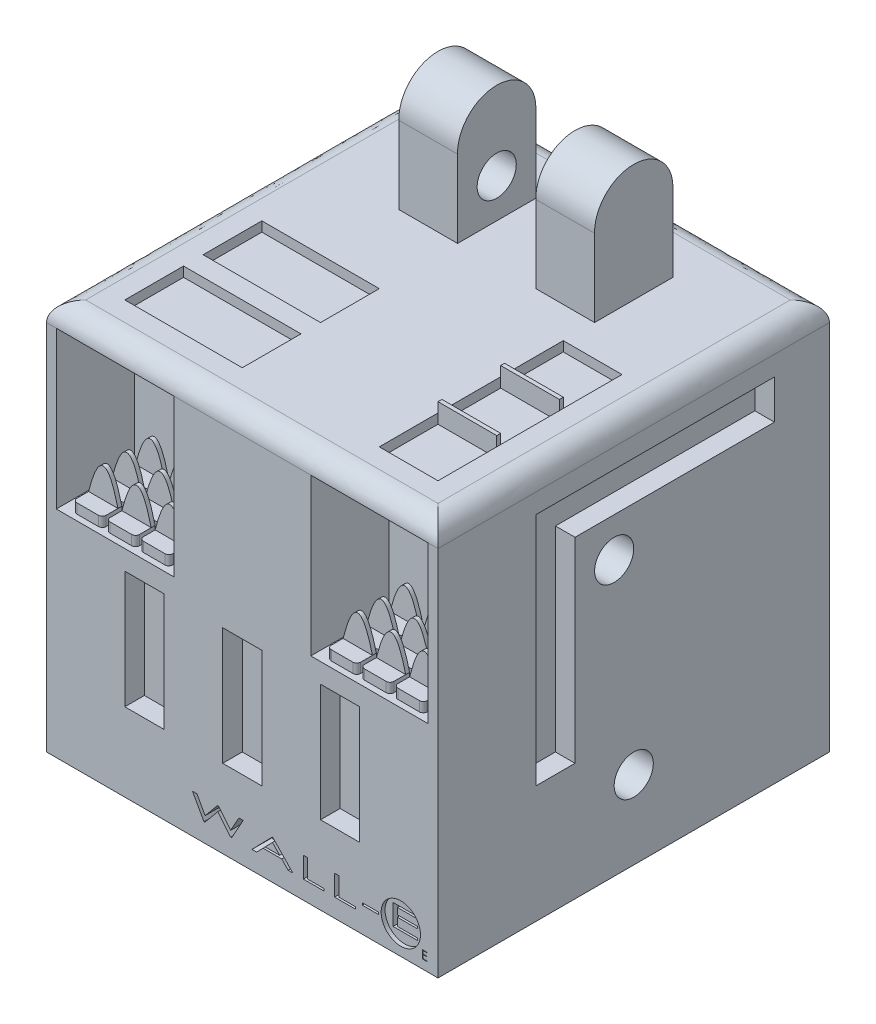
from build123d import *

# Parameters (mm, degrees)
SKETCH2_W            = 100
SKETCH2_H            = 100
BOSS_EXTRUDE1_DEPTH  = 100
VARFILLET1_R         = 5
SKETCH5_W            = 30
SKETCH5_H            = 40
CUT_EXTRUDE3_DEPTH   = 20
SKETCH7_W            = 10
SKETCH7_H            = 30
CUT_EXTRUDE4_DEPTH   = 5
SKETCH8_W            = 4.1383547
SKETCH8_H            = 0.542735043
CUT_EXTRUDE5_DEPTH   = 5
SKETCH9_R            = 5.029787576
CUT_EXTRUDE6_DEPTH   = 1
SKETCH11_W           = 30
SKETCH11_H           = 15
SKETCH11_W_2         = 15
CUT_EXTRUDE9_DEPTH   = 2.5
SKETCH18_W           = 15
SKETCH18_H           = 20
BOSS_EXTRUDE5_DEPTH  = 20
SKETCH19_R           = 10.003218186
BOSS_EXTRUDE6_DEPTH  = 15
SKETCH20_R           = 5
CUT_EXTRUDE11_DEPTH  = 10
SKETCH21_R           = 5
CUT_EXTRUDE12_DEPTH  = 10
CUT_EXTRUDE13_DEPTH  = 5
CUT_EXTRUDE14_DEPTH  = 0.1
SKETCH24_W           = 15
SKETCH24_H           = 1
BOSS_EXTRUDE8_DEPTH  = 2.5
SKETCH25_W           = 15
SKETCH25_H           = 1
BOSS_EXTRUDE9_DEPTH  = 2.5
BOSS_EXTRUDE10_DEPTH = 2.5
BOSS_EXTRUDE11_DEPTH = 1
BOSS_EXTRUDE12_DEPTH = 1
BOSS_EXTRUDE13_DEPTH = 1


with BuildPart() as part:
    # Sketch2 → Boss-Extrude1 (new body)
    with BuildSketch(Plane(origin=(0, 0, 0), x_dir=(1, 0, 0), z_dir=(0, 1, 0))):
        with Locations((28.106508876, -7.100591716)):
            Rectangle(SKETCH2_W, SKETCH2_H)
    extrude(amount=BOSS_EXTRUDE1_DEPTH)

    # VarFillet1
    varfillet1_edges = [part.edges().sort_by_distance(p)[0] for p in [
        (-21.893491124, 100, 7.100591716),
        (28.106508876, 100, -42.899408284),
        (78.106508876, 100, 7.100591716),
        (28.106508876, 100, 57.100591716),
    ]]
    fillet(varfillet1_edges, radius=VARFILLET1_R)

    # Sketch5 → Cut-Extrude3 (cut)
    with BuildSketch(Plane.XY.offset(57.100591716)):
        with Locations((-4.393491124, 75)):
            Rectangle(SKETCH5_W, SKETCH5_H)
        with Locations((60.606508876, 75)):
            Rectangle(SKETCH5_W, SKETCH5_H)
    extrude(amount=-CUT_EXTRUDE3_DEPTH, mode=Mode.SUBTRACT)

    # Sketch7 → Cut-Extrude4 (cut)
    with BuildSketch(Plane.XY.offset(57.100591716)):
        with Locations((3.106508876, 35)):
            Rectangle(SKETCH7_W, SKETCH7_H)
        with Locations((28.106508876, 35)):
            Rectangle(SKETCH7_W, SKETCH7_H)
        with Locations((53.106508876, 35)):
            Rectangle(SKETCH7_W, SKETCH7_H)
    extrude(amount=-CUT_EXTRUDE4_DEPTH, mode=Mode.SUBTRACT)

    # Sketch8 → Cut-Extrude5 (cut)
    # profile 1 of 6: a face of its own
    with BuildSketch(Plane.XY.offset(57.100591716)):
        Polygon((15.395497417, 9.974963751), (16.522308648, 9.974963751), (18.617986733, 6.175818452), (21.77051411, 9.974963751), (22.023861132, 9.974963751), (25.130807246, 6.175818452), (27.257226183, 9.974963751), (28.353296562, 9.974963751), (25.392634503, 4.683297084), (25.146707687, 4.683297084), (21.874396989, 8.685968024), (18.553324941, 4.683297084), (18.313758301, 4.683297084), align=None)
    # profile 2 of 6: a face of its own
    with BuildSketch(Plane.XY.offset(57.100591716)):
        Polygon((35.931234596, 9.974963751), (41.019375622, 4.683297084), (39.821542422, 4.683297084), (38.190157206, 6.379344093), (33.422145053, 6.379344093), (31.770619278, 4.683297084), (30.571726049, 4.683297084), (35.727708955, 9.974963751), align=None)
        Polygon((35.82205157, 8.842852373), (33.952159743, 6.922079135), (37.668622751, 6.922079135), align=None, mode=Mode.SUBTRACT)
    # profile 3 of 6: a face of its own
    with BuildSketch(Plane.XY.offset(57.100591716)):
        Polygon((43.712698272, 9.974963751), (44.798168357, 9.974963751), (44.798168357, 5.226032127), (49.004364938, 5.226032127), (49.004364938, 4.683297084), (43.712698272, 4.683297084), align=None)
    # profile 4 of 6: a face of its own
    with BuildSketch(Plane.XY.offset(57.100591716)):
        Polygon((51.697687588, 9.974963751), (52.783157673, 9.974963751), (52.783157673, 5.226032127), (56.989354254, 5.226032127), (56.989354254, 4.683297084), (51.697687588, 4.683297084), align=None)
    # profile 5 of 6: a face of its own
    with BuildSketch(Plane.XY.offset(57.100591716)):
        with Locations((60.86990981, 6.718553495)):
            Rectangle(SKETCH8_W, SKETCH8_H)
    # profile 6 of 6: a face of its own
    with BuildSketch(Plane.XY.offset(57.100591716)):
        Polygon((65.63240981, 9.974963751), (71.941704682, 9.974963751), (71.941704682, 9.432228708), (66.717879895, 9.432228708), (66.717879895, 7.80402358), (71.873862801, 7.80402358), (71.873862801, 7.261288537), (66.717879895, 7.261288537), (66.717879895, 5.226032127), (71.873862801, 5.226032127), (71.873862801, 4.683297084), (65.63240981, 4.683297084), align=None)
    extrude(amount=-CUT_EXTRUDE5_DEPTH, mode=Mode.SUBTRACT)

    # Sketch9 → Cut-Extrude6 (cut)
    with BuildSketch(Plane.XY.offset(57.100591716)):
        with Locations((68.606508876, 7.3)):
            Circle(SKETCH9_R)
    extrude(amount=-CUT_EXTRUDE6_DEPTH, mode=Mode.SUBTRACT)

    # Sketch11 → Cut-Extrude9 (cut)
    with BuildSketch(Plane(origin=(0, 100, 0), x_dir=(1, 0, 0), z_dir=(0, 1, 0))):
        with Locations((3.106508876, -39.600591716)):
            Rectangle(SKETCH11_W, SKETCH11_H)
        with Locations((3.106508876, -19.600591716)):
            Rectangle(SKETCH11_W, SKETCH11_H)
        with Locations((60.606508876, -39.600591716)):
            Rectangle(SKETCH11_W_2, SKETCH11_H)
        with Locations((60.606508876, -23.600591716)):
            Rectangle(SKETCH11_W_2, SKETCH11_H)
        with Locations((60.606508876, -7.600591716)):
            Rectangle(SKETCH11_W_2, SKETCH11_H)
    extrude(amount=-CUT_EXTRUDE9_DEPTH, mode=Mode.SUBTRACT)

    # Sketch18 → Boss-Extrude5 (add)
    with BuildSketch(Plane(origin=(0, 100, 0), x_dir=(1, 0, 0), z_dir=(0, 1, 0))):
        with Locations((10.606508876, 17.899408284)):
            Rectangle(SKETCH18_W, SKETCH18_H)
    boss_extrude5 = extrude(amount=BOSS_EXTRUDE5_DEPTH)

    # Sketch19 → Boss-Extrude6 (add)
    with BuildSketch(Plane.ZY.offset(-3.106508876)):
        with Locations((-17.899408284, 120)):
            Circle(SKETCH19_R)
    boss_extrude6 = extrude(amount=-BOSS_EXTRUDE6_DEPTH)

    # Sketch20 → Cut-Extrude11 (cut)
    with BuildSketch(Plane(origin=(18.106508876, 0, 0), x_dir=(0, 0, -1), z_dir=(1, 0, 0))):
        with Locations((17.899408284, 110)):
            Circle(SKETCH20_R)
    cut_extrude11 = extrude(amount=-CUT_EXTRUDE11_DEPTH, mode=Mode.SUBTRACT)

    # Sketch21 → Cut-Extrude12 (cut)
    with BuildSketch(Plane(origin=(78.106508876, 0, 0), x_dir=(0, 0, -1), z_dir=(1, 0, 0))):
        with Locations((-12.100591716, 70)):
            Circle(SKETCH21_R)
        with Locations((-7.100591716, 20)):
            Circle(SKETCH21_R)
    cut_extrude12 = extrude(amount=-CUT_EXTRUDE12_DEPTH, mode=Mode.SUBTRACT)

    # Mirror4: Cut-Extrude12 across plane
    add(cut_extrude12.mirror(Plane.ZY.offset(-28.106508876)), mode=Mode.SUBTRACT)

    # Sketch10 → Cut-Extrude13 (cut)
    with BuildSketch(Plane(origin=(78.106508876, 0, 0), x_dir=(0, 0, -1), z_dir=(1, 0, 0))):
        Polygon((-32.100591716, 90), (28.837688011, 90), (28.837688011, 80), (-22.100591716, 80), (-22.100591716, 30), (-32.100591716, 30), align=None)
    cut_extrude13 = extrude(amount=-CUT_EXTRUDE13_DEPTH, mode=Mode.SUBTRACT)

    # Mirror5: Cut-Extrude13 across plane
    add(cut_extrude13.mirror(Plane.ZY.offset(-28.106508876)), mode=Mode.SUBTRACT)

    # Mirror7: Boss-Extrude5, Boss-Extrude6, Cut-Extrude11 across plane
    add(boss_extrude5.mirror(Plane.ZY.offset(-28.106508876)))
    add(boss_extrude6.mirror(Plane.ZY.offset(-28.106508876)))
    add(cut_extrude11.mirror(Plane.ZY.offset(-28.106508876)), mode=Mode.SUBTRACT)

    # Sketch22 → Cut-Extrude14 (cut)
    with BuildSketch(Plane.XY.offset(57.100591716)):
        Polygon((74.114333694, 4.350821723), (75.308350788, 4.350821723), (75.308350788, 4.133727706), (74.304290959, 4.133727706), (74.304290959, 3.482445655), (75.308350788, 3.482445655), (75.308350788, 3.265351638), (74.304290959, 3.265351638), (74.304290959, 2.451249074), (75.308350788, 2.451249074), (75.308350788, 2.234155057), (74.114333694, 2.234155057), align=None)
    extrude(amount=-CUT_EXTRUDE14_DEPTH, mode=Mode.SUBTRACT)

    # Sketch24 → Boss-Extrude8 (add)
    with BuildSketch(Plane(origin=(0, 100, 0), x_dir=(1, 0, 0), z_dir=(0, 1, 0))):
        with Locations((60.606508876, -15.600591716)):
            Rectangle(SKETCH24_W, SKETCH24_H)
    extrude(amount=BOSS_EXTRUDE8_DEPTH)

    # Sketch25 → Boss-Extrude9 (add)
    with BuildSketch(Plane(origin=(0, 100, 0), x_dir=(1, 0, 0), z_dir=(0, 1, 0))):
        with Locations((60.606508876, -31.600591716)):
            Rectangle(SKETCH25_W, SKETCH25_H)
    extrude(amount=BOSS_EXTRUDE9_DEPTH)

    # Sketch26 → Boss-Extrude10 (add)
    with BuildSketch(Plane(origin=(0, 55, 0), x_dir=(1, 0, 0), z_dir=(0, 1, 0))):
        with BuildLine():
            Line((48.356508876, -38.600591716), (55.856508876, -38.600591716))
            Line((55.856508876, -38.600591716), (55.856508876, -42.600591716))
            ThreePointArc((55.856508876, -42.600591716), (55.563615657, -43.307698497), (54.856508876, -43.600591716))
            Line((54.856508876, -43.600591716), (49.356508876, -43.600591716))
            ThreePointArc((49.356508876, -43.600591716), (48.649402095, -43.307698497), (48.356508876, -42.600591716))
            Line((48.356508876, -42.600591716), (48.356508876, -38.600591716))
        make_face()
        with BuildLine():
            Line((57.856508876, -43.600591716), (63.356508876, -43.600591716))
            ThreePointArc((63.356508876, -43.600591716), (64.063615657, -43.307698497), (64.356508876, -42.600591716))
            Line((64.356508876, -42.600591716), (64.356508876, -38.600591716))
            Line((64.356508876, -38.600591716), (56.856508876, -38.600591716))
            Line((56.856508876, -38.600591716), (56.856508876, -42.600591716))
            ThreePointArc((56.856508876, -42.600591716), (57.149402095, -43.307698497), (57.856508876, -43.600591716))
        make_face()
        with BuildLine():
            Line((65.356508876, -38.600591716), (72.856508876, -38.600591716))
            Line((72.856508876, -38.600591716), (72.856508876, -42.600591716))
            ThreePointArc((72.856508876, -42.600591716), (72.563615657, -43.307698497), (71.856508876, -43.600591716))
            Line((71.856508876, -43.600591716), (66.356508876, -43.600591716))
            ThreePointArc((66.356508876, -43.600591716), (65.649402095, -43.307698497), (65.356508876, -42.600591716))
            Line((65.356508876, -42.600591716), (65.356508876, -38.600591716))
        make_face()
        with BuildLine():
            Line((48.356508876, -44.600591716), (55.856508876, -44.600591716))
            Line((55.856508876, -44.600591716), (55.856508876, -48.600591716))
            ThreePointArc((55.856508876, -48.600591716), (55.563615657, -49.307698497), (54.856508876, -49.600591716))
            Line((54.856508876, -49.600591716), (49.356508876, -49.600591716))
            ThreePointArc((49.356508876, -49.600591716), (48.649402095, -49.307698497), (48.356508876, -48.600591716))
            Line((48.356508876, -48.600591716), (48.356508876, -44.600591716))
        make_face()
        with BuildLine():
            Line((56.856508876, -44.600591716), (64.356508876, -44.600591716))
            Line((64.356508876, -44.600591716), (64.356508876, -48.600591716))
            ThreePointArc((64.356508876, -48.600591716), (64.063615657, -49.307698497), (63.356508876, -49.600591716))
            Line((63.356508876, -49.600591716), (57.856508876, -49.600591716))
            ThreePointArc((57.856508876, -49.600591716), (57.149402095, -49.307698497), (56.856508876, -48.600591716))
            Line((56.856508876, -48.600591716), (56.856508876, -44.600591716))
        make_face()
        with BuildLine():
            Line((65.356508876, -44.600591716), (72.856508876, -44.600591716))
            Line((72.856508876, -44.600591716), (72.856508876, -48.600591716))
            ThreePointArc((72.856508876, -48.600591716), (72.563615657, -49.307698497), (71.856508876, -49.600591716))
            Line((71.856508876, -49.600591716), (66.356508876, -49.600591716))
            ThreePointArc((66.356508876, -49.600591716), (65.649402095, -49.307698497), (65.356508876, -48.600591716))
            Line((65.356508876, -48.600591716), (65.356508876, -44.600591716))
        make_face()
        with BuildLine():
            Line((48.356508876, -50.600591716), (55.856508876, -50.600591716))
            Line((55.856508876, -50.600591716), (55.856508876, -54.600591716))
            ThreePointArc((55.856508876, -54.600591716), (55.563615657, -55.307698497), (54.856508876, -55.600591716))
            Line((54.856508876, -55.600591716), (49.356508876, -55.600591716))
            ThreePointArc((49.356508876, -55.600591716), (48.649402095, -55.307698497), (48.356508876, -54.600591716))
            Line((48.356508876, -54.600591716), (48.356508876, -50.600591716))
        make_face()
        with BuildLine():
            Line((56.856508876, -50.600591716), (64.356508876, -50.600591716))
            Line((64.356508876, -50.600591716), (64.356508876, -54.600591716))
            ThreePointArc((64.356508876, -54.600591716), (64.063615657, -55.307698497), (63.356508876, -55.600591716))
            Line((63.356508876, -55.600591716), (57.856508876, -55.600591716))
            ThreePointArc((57.856508876, -55.600591716), (57.149402095, -55.307698497), (56.856508876, -54.600591716))
            Line((56.856508876, -54.600591716), (56.856508876, -50.600591716))
        make_face()
        with BuildLine():
            Line((65.356508876, -50.600591716), (72.856508876, -50.600591716))
            Line((72.856508876, -50.600591716), (72.856508876, -54.600591716))
            ThreePointArc((72.856508876, -54.600591716), (72.563615657, -55.307698497), (71.856508876, -55.600591716))
            Line((71.856508876, -55.600591716), (66.356508876, -55.600591716))
            ThreePointArc((66.356508876, -55.600591716), (65.649402095, -55.307698497), (65.356508876, -54.600591716))
            Line((65.356508876, -54.600591716), (65.356508876, -50.600591716))
        make_face()
    boss_extrude10 = extrude(amount=BOSS_EXTRUDE10_DEPTH)

    # Sketch27 → Boss-Extrude11 (add)
    with BuildSketch(Plane(origin=(0, 0, 38.600591716), x_dir=(-1, 0, 0), z_dir=(0, 0, -1))):
        with BuildLine():
            Line((-48.356508876, 57.5), (-55.856508876, 57.5))
            add(Edge.make_bspline(
                [(-48.356508876, 57.5), (-52.106508876, 72.5), (-55.856508876, 57.5)],
                knots=[0, 0, 0, 1, 1, 1], degree=2))
        make_face()
        with BuildLine():
            Line((-56.856508876, 57.5), (-64.356508876, 57.5))
            add(Edge.make_bspline(
                [(-56.856508876, 57.5), (-60.606508876, 72.5), (-64.356508876, 57.5)],
                knots=[0, 0, 0, 1, 1, 1], degree=2))
        make_face()
        with BuildLine():
            Line((-65.356508876, 57.5), (-72.856508876, 57.5))
            add(Edge.make_bspline(
                [(-65.356508876, 57.5), (-69.106508876, 72.5), (-72.856508876, 57.5)],
                knots=[0, 0, 0, 1, 1, 1], degree=2))
        make_face()
    boss_extrude11 = extrude(amount=-BOSS_EXTRUDE11_DEPTH)

    # Sketch28 → Boss-Extrude12 (add)
    with BuildSketch(Plane(origin=(0, 0, 44.600591716), x_dir=(-1, 0, 0), z_dir=(0, 0, -1))):
        with BuildLine():
            Line((-48.356508876, 57.5), (-55.856508876, 57.5))
            add(Edge.make_bspline(
                [(-48.356508876, 57.5), (-52.106508876, 72.5), (-55.856508876, 57.5)],
                knots=[0, 0, 0, 1, 1, 1], degree=2))
        make_face()
        with BuildLine():
            Line((-56.856508876, 57.5), (-64.356508876, 57.5))
            add(Edge.make_bspline(
                [(-56.856508876, 57.5), (-60.606508876, 72.5), (-64.356508876, 57.5)],
                knots=[0, 0, 0, 1, 1, 1], degree=2))
        make_face()
        with BuildLine():
            Line((-65.356508876, 57.5), (-72.856508876, 57.5))
            add(Edge.make_bspline(
                [(-65.356508876, 57.5), (-69.106508876, 72.5), (-72.856508876, 57.5)],
                knots=[0, 0, 0, 1, 1, 1], degree=2))
        make_face()
    boss_extrude12 = extrude(amount=-BOSS_EXTRUDE12_DEPTH)

    # Sketch29 → Boss-Extrude13 (add)
    with BuildSketch(Plane(origin=(0, 0, 50.600591716), x_dir=(-1, 0, 0), z_dir=(0, 0, -1))):
        with BuildLine():
            Line((-48.356508876, 57.5), (-55.856508876, 57.5))
            add(Edge.make_bspline(
                [(-48.356508876, 57.5), (-52.106508876, 72.5), (-55.856508876, 57.5)],
                knots=[0, 0, 0, 1, 1, 1], degree=2))
        make_face()
        with BuildLine():
            Line((-56.856508876, 57.5), (-64.356508876, 57.5))
            add(Edge.make_bspline(
                [(-56.856508876, 57.5), (-60.606508876, 72.5), (-64.356508876, 57.5)],
                knots=[0, 0, 0, 1, 1, 1], degree=2))
        make_face()
        with BuildLine():
            Line((-65.356508876, 57.5), (-72.856508876, 57.5))
            add(Edge.make_bspline(
                [(-65.356508876, 57.5), (-69.106508876, 72.5), (-72.856508876, 57.5)],
                knots=[0, 0, 0, 1, 1, 1], degree=2))
        make_face()
    boss_extrude13 = extrude(amount=-BOSS_EXTRUDE13_DEPTH)

    # Mirror10: Boss-Extrude10, Boss-Extrude11, Boss-Extrude12, Boss-Extrude13 across plane
    add(boss_extrude10.mirror(Plane.ZY.offset(-28.106508876)))
    add(boss_extrude11.mirror(Plane.ZY.offset(-28.106508876)))
    add(boss_extrude12.mirror(Plane.ZY.offset(-28.106508876)))
    add(boss_extrude13.mirror(Plane.ZY.offset(-28.106508876)))


solid = part.part
